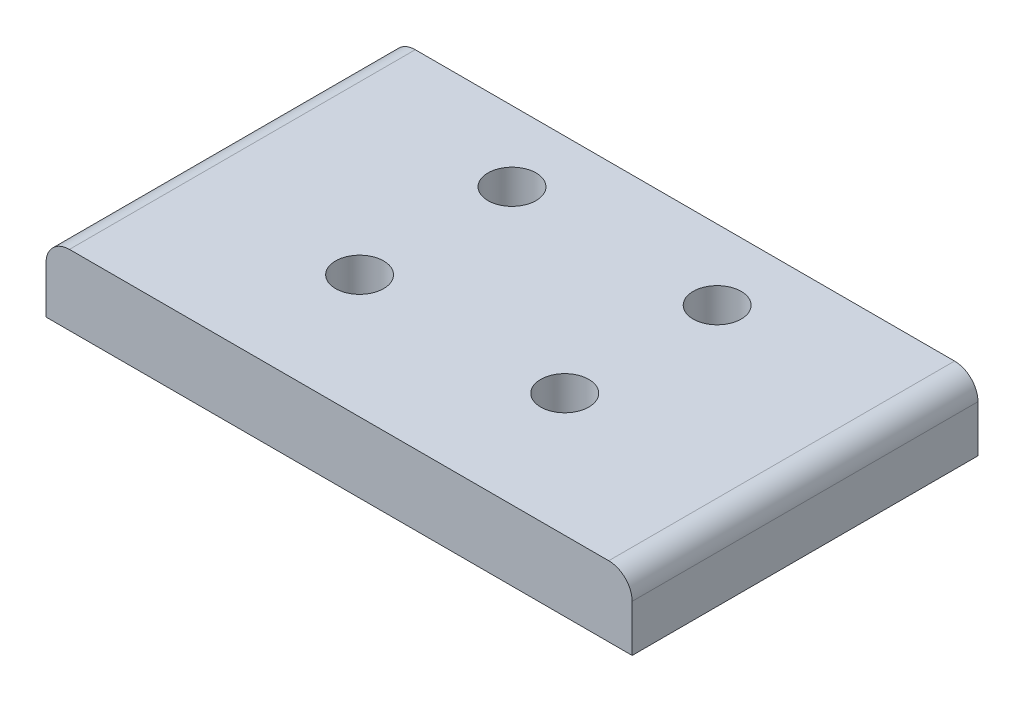
from build123d import *

# Parameters (mm, degrees)
SKETCH1_W             = 50
SKETCH1_H             = 29.5
BOSS_EXTRUDE1_DEPTH   = 6
FILLET1_R             = 2
FILLET2_R             = 2
F_4_0MM_DOWEL_HOLE2_D = 4.1


with BuildPart() as part:
    # Sketch1 → Boss-Extrude1 (new body)
    with BuildSketch(Plane(origin=(0, 0, 0), x_dir=(1, 0, 0), z_dir=(0, 1, 0))):
        with Locations((25, 14.75)):
            Rectangle(SKETCH1_W, SKETCH1_H)
    extrude(amount=BOSS_EXTRUDE1_DEPTH)

    # Fillet1
    fillet1_edges = [part.edges().sort_by_distance(p)[0] for p in [
        (0, 6, -14.75),
    ]]
    fillet(fillet1_edges, radius=FILLET1_R)

    # Fillet2
    fillet2_edges = [part.edges().sort_by_distance(p)[0] for p in [
        (50, 6, -14.75),
    ]]
    fillet(fillet2_edges, radius=FILLET2_R)

    # Ø4.0mm Dowel Hole2 (through all)
    with Locations(Plane(origin=(16.25, 0, -23.5), x_dir=(0, 0, -1), z_dir=(0, -1, 0))):
        with Locations((0, 0), (0, 17.5), (-13, 17.5), (-13, 0)):
            Hole(F_4_0MM_DOWEL_HOLE2_D / 2)


solid = part.part
